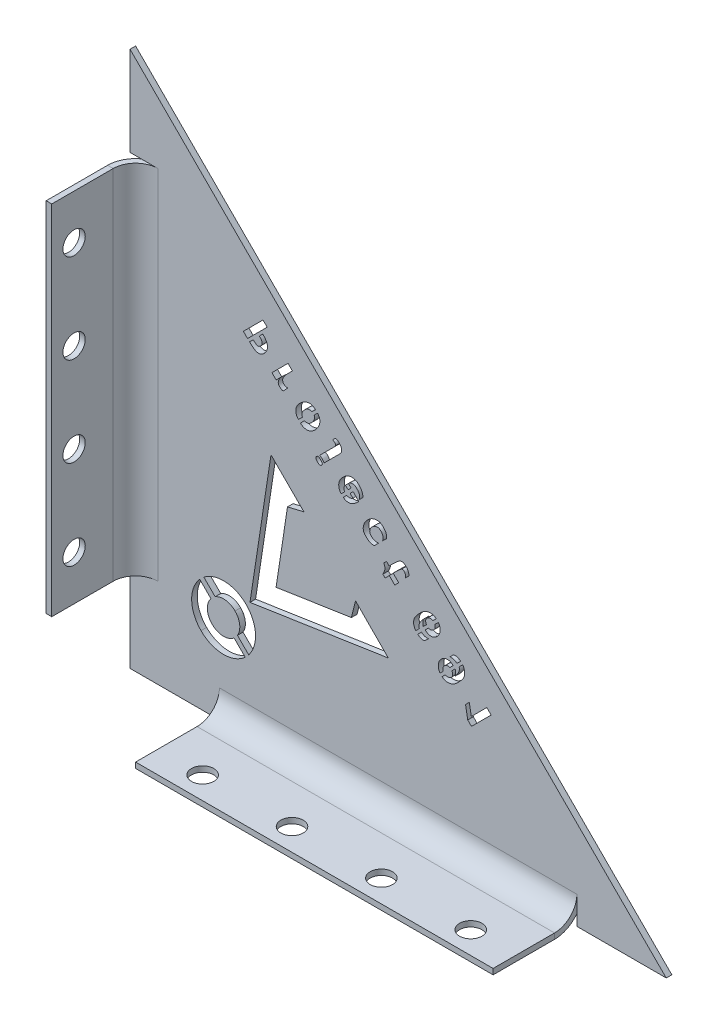
from build123d import *

# Parameters (mm, degrees)
BOSS_EXTRUDE1_DEPTH          = 1.5875
SKETCH7_W                    = 1.5875
SKETCH7_H                    = 101.6
BOSS_EXTRUDE2_DEPTH          = 0.0254
EDGE_FLANGE1_STRIP_W         = 19.05
EDGE_FLANGE1_STRIP_H         = 1.5875
EDGE_FLANGE1_STRIP_CUT_DEPTH = 101.6
EDGE_FLANGE1_DEPTH           = 101.6
SKETCH11_W                   = 101.6
SKETCH11_H                   = 1.5875
BOSS_EXTRUDE3_DEPTH          = 0.0254
EDGE_FLANGE2_STRIP_W         = 19.05
EDGE_FLANGE2_STRIP_H         = 1.5875
EDGE_FLANGE2_STRIP_CUT_DEPTH = 101.6
EDGE_FLANGE2_DEPTH           = 101.6
SKETCH15_R                   = 3.175
CUT_EXTRUDE1_DEPTH           = 2.54
SKETCH16_R                   = 3.175
CUT_EXTRUDE2_DEPTH           = 2.54
CUT_EXTRUDE3_DEPTH           = 2.54
CUT_EXTRUDE4_DEPTH           = 2.54


# Sheet-metal steps are written as plain solids
with BuildPart() as part:
    # Sketch1 → Boss-Extrude1 (new body)
    with BuildSketch(Plane.XY):
        Polygon((0, 119.481843199), (0, -32.918156801), (152.4, -32.918156801), align=None)
    extrude(amount=BOSS_EXTRUDE1_DEPTH)

    # Sketch7 → Boss-Extrude2 (add)
    with BuildSketch(Plane.ZY):
        with Locations((0.79375, 43.281843199)):
            Rectangle(SKETCH7_W, SKETCH7_H)
    extrude(amount=BOSS_EXTRUDE2_DEPTH)

    # Edge-Flange1 strip (across the edge) → Edge-Flange1 strip cut (cut)
    with BuildSketch(Plane(origin=(-0.0254, 94.081843199, 1.5875), x_dir=(1, 0, 0), z_dir=(0, -1, 0))):
        with Locations((-1.5875, -0.79375)):
            Rectangle(EDGE_FLANGE1_STRIP_W, EDGE_FLANGE1_STRIP_H)
    extrude(amount=EDGE_FLANGE1_STRIP_CUT_DEPTH, mode=Mode.SUBTRACT)

    # Edge-Flange1 section (across the edge) → Edge-Flange1 (add)
    with BuildSketch(Plane(origin=(-0.0254, 94.081843199, 1.5875), x_dir=(1, 0, 0), z_dir=(0, -1, 0))):
        with BuildLine():
            Line((0, 6.35), (0, 23.8125))
            Line((0, 23.8125), (1.5875, 23.8125))
            Line((1.5875, 23.8125), (1.5875, 6.35))
            ThreePointArc((1.5875, 6.35), (3.447371939, 1.859871939), (7.9375, 0))
            Line((7.9375, 0), (7.9375, -1.5875))
            ThreePointArc((7.9375, -1.5875), (2.324839924, 0.737339924), (0, 6.35))
        make_face()
    extrude(amount=EDGE_FLANGE1_DEPTH)

    # Sketch11 → Boss-Extrude3 (add)
    with BuildSketch(Plane(origin=(0, -32.918156801, 0), x_dir=(-1, 0, 0), z_dir=(0, -1, 0))):
        with Locations((-76.2, -0.79375)):
            Rectangle(SKETCH11_W, SKETCH11_H)
    extrude(amount=BOSS_EXTRUDE3_DEPTH)

    # Edge-Flange2 strip (across the edge) → Edge-Flange2 strip cut (cut)
    with BuildSketch(Plane(origin=(25.4, -32.943556801, 1.5875), x_dir=(0, 1, 0), z_dir=(1, 0, 0))):
        with Locations((-1.5875, -0.79375)):
            Rectangle(EDGE_FLANGE2_STRIP_W, EDGE_FLANGE2_STRIP_H)
    extrude(amount=EDGE_FLANGE2_STRIP_CUT_DEPTH, mode=Mode.SUBTRACT)

    # Edge-Flange2 section (across the edge) → Edge-Flange2 (add)
    with BuildSketch(Plane(origin=(25.4, -32.943556801, 1.5875), x_dir=(0, 1, 0), z_dir=(1, 0, 0))):
        with BuildLine():
            Line((0, 6.35), (0, 23.8125))
            Line((0, 23.8125), (1.5875, 23.8125))
            Line((1.5875, 23.8125), (1.5875, 6.35))
            ThreePointArc((1.5875, 6.35), (3.447371939, 1.859871939), (7.9375, 0))
            Line((7.9375, 0), (7.9375, -1.5875))
            ThreePointArc((7.9375, -1.5875), (2.324839924, 0.737339924), (0, 6.35))
        make_face()
    extrude(amount=EDGE_FLANGE2_DEPTH)

    # Sketch15 → Cut-Extrude1 (cut)
    with BuildSketch(Plane(origin=(0, -31.356056801, 0), x_dir=(1, 0, 0), z_dir=(0, 1, 0))):
        with Locations(Location((38.1, -19.05, 0), (0, 0, 270))):
            Circle(SKETCH15_R)
        with Locations(Location((63.5, -19.05, 0), (0, 0, 270))):
            Circle(SKETCH15_R)
        with Locations(Location((88.9, -19.05, 0), (0, 0, 270))):
            Circle(SKETCH15_R)
        with Locations(Location((114.3, -19.05, 0), (0, 0, 270))):
            Circle(SKETCH15_R)
    extrude(amount=-CUT_EXTRUDE1_DEPTH, mode=Mode.SUBTRACT)

    # Sketch16 → Cut-Extrude2 (cut)
    with BuildSketch(Plane(origin=(1.5621, 0, 0), x_dir=(0, 0, -1), z_dir=(1, 0, 0))):
        with Locations((-19.05, 81.381843199)):
            Circle(SKETCH16_R)
        with Locations((-19.05, 55.981843199)):
            Circle(SKETCH16_R)
        with Locations((-19.05, 30.581843199)):
            Circle(SKETCH16_R)
        with Locations((-19.05, 5.181843199)):
            Circle(SKETCH16_R)
    extrude(amount=-CUT_EXTRUDE2_DEPTH, mode=Mode.SUBTRACT)

    # Sketch18 → Cut-Extrude3 (cut)
    with BuildSketch(Plane(origin=(0, 0, 0), x_dir=(-1, 0, 0), z_dir=(0, 0, -1))):
        with BuildLine():
            Line((-62.918328796, 11.048103988), (-64.087135711, 15.755195036))
            Line((-64.087135711, 15.755195036), (-73.399282558, 6.348037368))
            Line((-73.399282558, 6.348037368), (-34.088047875, 0.383573675))
            Line((-34.088047875, 0.383573675), (-40.066632841, 39.680687084))
            Line((-40.066632841, 39.680687084), (-49.413539744, 30.333780181))
            Line((-49.413539744, 30.333780181), (-44.754388608, 29.212913177))
            add(Edge.make_bspline(
                [(-44.754388608, 29.212913177), (-43.939337688, 23.844729295), (-42.880097369, 16.867299609), (-41.50388878, 7.79941458)],
                knots=[0, 0, 0, 0, 1, 1, 1, 1], degree=3))
            add(Edge.make_bspline(
                [(-41.50388878, 7.79941458), (-50.571846226, 9.175550752), (-57.549710413, 10.233487569), (-62.918328796, 11.048103988)],
                knots=[0, 0, 0, 0, 1, 1, 1, 1], degree=3))
        make_face()
        with BuildLine():
            Line((-20.989695693, 0.025611542), (-24.192926626, -3.177619391))
            add(Edge.make_bspline(
                [(-29.846089839, -3.858384361), (-28.312500508, -2.324795029), (-25.966837326, -2.097873373), (-24.192926626, -3.177619391)],
                knots=[0, 0, 0, 0, 0.85203232, 0.85203232, 0.85203232, 0.85203232], degree=3))
            add(Edge.make_bspline(
                [(-30.526922938, -9.511615704), (-31.606653399, -7.737689446), (-31.379679171, -5.391973692), (-29.846089839, -3.858384361)],
                knots=[0.147967681, 0.147967681, 0.147967681, 0.147967681, 1, 1, 1, 1], degree=3))
            Line((-30.526922938, -9.511615704), (-33.73015778, -12.714850546))
            add(Edge.make_bspline(
                [(-33.73015778, -12.714850546), (-36.52704349, -9.153940448), (-36.284613381, -3.98259872), (-33.00280993, -0.700795269)],
                knots=[0.073871002, 0.073871002, 0.073871002, 0.073871002, 1, 1, 1, 1], degree=3))
            add(Edge.make_bspline(
                [(-33.00280993, -0.700795269), (-29.721878353, 2.580136308), (-24.550601032, 2.82250201), (-20.989695693, 0.025611542)],
                knots=[0, 0, 0, 0, 0.926128998, 0.926128998, 0.926128998, 0.926128998], degree=3))
        make_face()
        with BuildLine():
            Line((-29.567715607, -10.633621883), (-32.730234943, -13.796141219))
            add(Edge.make_bspline(
                [(-20.170048646, -13.533556552), (-23.624097654, -16.98760556), (-29.17123496, -17.074865519), (-32.730234943, -13.796141219)],
                knots=[0, 0, 0, 0, 0.974736908, 0.974736908, 0.974736908, 0.974736908], degree=3))
            add(Edge.make_bspline(
                [(-19.81220621, -1.080382551), (-16.631732942, -4.642721603), (-16.751035453, -10.114543359), (-20.170048646, -13.533556552)],
                knots=[0.034893843, 0.034893843, 0.034893843, 0.034893843, 1, 1, 1, 1], degree=3))
            Line((-19.81220621, -1.080382551), (-22.979590243, -4.247766584))
            add(Edge.make_bspline(
                [(-22.979590243, -4.247766584), (-21.536353783, -6.057312027), (-21.652389077, -8.701587801), (-23.327637738, -10.376836462)],
                knots=[0.06926452, 0.06926452, 0.06926452, 0.06926452, 1, 1, 1, 1], degree=3))
            add(Edge.make_bspline(
                [(-23.327637738, -10.376836462), (-25.03745463, -12.086653354), (-27.756767726, -12.172310571), (-29.567715607, -10.633621883)],
                knots=[0, 0, 0, 0, 0.949940915, 0.949940915, 0.949940915, 0.949940915], degree=3))
        make_face()
    extrude(amount=-CUT_EXTRUDE3_DEPTH, mode=Mode.SUBTRACT)

    # Sketch19 → Cut-Extrude4 (cut)
    with BuildSketch(Plane(origin=(0, 0, 0), x_dir=(-1, 0, 0), z_dir=(0, 0, -1))):
        with BuildLine():
            add(Edge.make_bspline(
                [(-54.451629709, 44.308400165), (-54.486216356, 44.347097669), (-54.552844966, 44.421645541), (-54.619431381, 44.554473369), (-54.644885888, 44.696657055), (-54.635652404, 44.845922248), (-54.586551979, 45.002877848), (-54.494039294, 45.164239512), (-54.370016404, 45.338062039), (-54.208899848, 45.506933329), (-54.038541356, 45.667558131), (-53.86728466, 45.796755143), (-53.705735912, 45.89260812), (-53.550339865, 45.947667342), (-53.401150145, 45.968395547), (-53.258558385, 45.944748504), (-53.125321358, 45.881598423), (-53.008521132, 45.783078955), (-52.908409106, 45.665084526), (-52.844147531, 45.525943286), (-52.818369511, 45.375023534), (-52.829681514, 45.214256535), (-52.880338366, 45.048503358), (-52.965261587, 44.877991305), (-53.089546945, 44.707389018), (-53.242168849, 44.54028881), (-53.406291032, 44.385842409), (-53.576008153, 44.2647164), (-53.738514348, 44.175383143), (-53.897071431, 44.122809093), (-54.050611902, 44.109146281), (-54.197235932, 44.13527054), (-54.333892833, 44.204126421), (-54.411237162, 44.272626479), (-54.451629709, 44.308400165)],
                knots=[0, 0, 0, 0, 0.89096093, 1.716370149, 2.519710242, 3.350237323, 4.268177873, 5.323688382, 6.539873258, 7.936784, 9.333694741, 10.567414482, 11.623893583, 12.554062634, 13.388976487, 14.188914126, 15.005781945, 15.896742875, 16.80159031, 17.649470878, 18.50136307, 19.41130979, 20.398285583, 21.466456066, 22.676900497, 24.018679477, 25.359804904, 26.548445057, 27.599284631, 28.541936938, 29.403380809, 30.226130366, 31.073608727, 32, 32, 32, 32], degree=3))
        make_face()
        Polygon((-97.041095461, 1.333701079), (-102.620099628, 6.912705246), (-101.390448586, 8.142356288), (-96.99810067, 3.750008371), (-96.421970461, 6.953980246), (-95.359139211, 5.891148996), (-95.98686317, 2.387933371), align=None)
        with BuildLine():
            Line((-93.953304581, 15.81339196), (-92.890473331, 14.75056071))
            add(Edge.make_bspline(
                [(-92.890473331, 14.75056071), (-92.827020703, 14.81059733), (-92.701447887, 14.929409864), (-92.492119234, 15.078359799), (-92.271478041, 15.202284832), (-92.037393519, 15.299625522), (-91.78672288, 15.368897662), (-91.518953423, 15.409021657), (-91.2324372, 15.423864597), (-91.036488157, 15.409695365), (-90.935070206, 15.402361752)],
                knots=[0, 0, 0, 0, 0.980817489, 1.941038821, 2.878509081, 3.820198868, 4.783140073, 5.793726477, 6.858092202, 8, 8, 8, 8], degree=3))
            Line((-90.935070206, 15.402361752), (-91.939428539, 16.406720085))
            add(Edge.make_bspline(
                [(-91.939428539, 16.406720085), (-91.993165972, 16.418939645), (-92.098857026, 16.442973138), (-92.258077532, 16.465620673), (-92.414584879, 16.474358391), (-92.568844285, 16.46923621), (-92.720262944, 16.450371927), (-92.868851097, 16.4176688), (-93.014099424, 16.370516387), (-93.198067554, 16.293917403), (-93.407190155, 16.189744697), (-93.627185453, 16.062698213), (-93.809767033, 15.943255505), (-93.908336009, 15.854076633), (-93.953304581, 15.81339196)],
                knots=[0, 0, 0, 0, 0.906066358, 1.782055884, 2.641294935, 3.480860537, 4.316978217, 5.147335385, 5.979189849, 6.824821184, 8.422826787, 9.816763711, 11.003976472, 12, 12, 12, 12], degree=3))
        make_face()
        with BuildLine():
            Line((-91.829361872, 13.689449252), (-90.900674372, 12.760761752))
            add(Edge.make_bspline(
                [(-90.900674372, 12.760761752), (-90.865046013, 12.778612267), (-90.786299141, 12.818066014), (-90.643909555, 12.853690463), (-90.471358878, 12.873514374), (-90.272722226, 12.884591741), (-90.054211337, 12.864226473), (-89.832377466, 12.782128668), (-89.616102321, 12.645750751), (-89.412378329, 12.464567674), (-89.229701124, 12.262953791), (-89.081677229, 12.05560123), (-88.978372056, 11.848737195), (-88.922837448, 11.643694736), (-88.90655937, 11.446448819), (-88.916750773, 11.259190232), (-88.961433038, 11.081178039), (-89.015975628, 10.974184384), (-89.043299372, 10.920584668)],
                knots=[0, 0, 0, 0, 0.572085397, 1.26444038, 2.09625672, 3.070483045, 4.124420694, 5.228059518, 6.43908216, 7.783856681, 9.138863522, 10.347129936, 11.439116606, 12.447625815, 13.383377729, 14.276112387, 15.136398451, 16, 16, 16, 16], degree=3))
            Line((-89.043299372, 10.920584668), (-88.123210831, 10.000496127))
            add(Edge.make_bspline(
                [(-88.123210831, 10.000496127), (-88.082613908, 10.04548828), (-88.000236962, 10.136783776), (-87.893894157, 10.292878584), (-87.809570633, 10.470904124), (-87.736046463, 10.66546123), (-87.683128216, 10.88049402), (-87.639940334, 11.113416514), (-87.620970711, 11.366235546), (-87.609935458, 11.632628123), (-87.623929923, 11.904280281), (-87.660394655, 12.17257981), (-87.72704783, 12.430825807), (-87.81613279, 12.681079235), (-87.934569663, 12.920789181), (-88.077536649, 13.152055351), (-88.247666053, 13.373173895), (-88.440077953, 13.581206228), (-88.645217386, 13.773318753), (-88.856778748, 13.942590593), (-89.071120764, 14.085769735), (-89.286140919, 14.206801892), (-89.50662817, 14.297554693), (-89.728506548, 14.366403101), (-89.95451886, 14.405135213), (-90.181072416, 14.421538348), (-90.40647744, 14.410248356), (-90.627217845, 14.37790837), (-90.842528353, 14.322683011), (-91.052166568, 14.242435821), (-91.256545267, 14.139011842), (-91.45560899, 14.012779996), (-91.647390526, 13.861639905), (-91.76774808, 13.747751393), (-91.829361872, 13.689449252)],
                knots=[0, 0, 0, 0, 0.749332702, 1.520502905, 2.326225067, 3.181293294, 4.089626218, 5.062179955, 6.108903827, 7.223051897, 8.359331748, 9.469748303, 10.567291151, 11.653221413, 12.75078718, 13.868789315, 15.012219258, 16.196922747, 17.371218932, 18.486698271, 19.545060865, 20.557780294, 21.533871024, 22.48975453, 23.426150137, 24.364585121, 25.294727598, 26.212564909, 27.120897833, 28.039063961, 28.98433606, 29.950480165, 30.950803785, 32, 32, 32, 32], degree=3))
        make_face()
        with BuildLine():
            add(Edge.make_bspline(
                [(-92.381414997, 13.137396127), (-92.401408019, 13.093668754), (-92.444054479, 13.000395323), (-92.488598898, 12.842843104), (-92.522393509, 12.662722038), (-92.545666044, 12.458206646), (-92.547858581, 12.224483646), (-92.51554026, 11.959650592), (-92.454557546, 11.662090246), (-92.395505671, 11.455065245), (-92.364217081, 11.34537321)],
                knots=[0, 0, 0, 0, 0.62829261, 1.340190433, 2.134471608, 3.024813884, 4.029827998, 5.184373668, 6.508142579, 8, 8, 8, 8], degree=3))
            add(Edge.make_bspline(
                [(-92.364217081, 11.34537321), (-92.431804593, 11.42117066), (-92.563634646, 11.569014269), (-92.748121922, 11.793046799), (-92.915441014, 12.013116992), (-93.064818903, 12.229703559), (-93.198429474, 12.441453372), (-93.313406893, 12.650347094), (-93.414677041, 12.854223543), (-93.493931047, 13.054527701), (-93.558434918, 13.244258279), (-93.603360511, 13.42132269), (-93.631244629, 13.583577491), (-93.635970005, 13.730845421), (-93.626231495, 13.864138642), (-93.59259236, 13.981852104), (-93.54348607, 14.087966721), (-93.493338721, 14.144506523), (-93.468323331, 14.17271071)],
                knots=[0, 0, 0, 0, 1.505393456, 2.936283515, 4.301144198, 5.602399503, 6.835634825, 8.011059706, 9.136095676, 10.2076363, 11.201985935, 12.104778921, 12.913735962, 13.636550114, 14.285162681, 14.885188552, 15.443889973, 16, 16, 16, 16], degree=3))
            Line((-93.468323331, 14.17271071), (-94.531154581, 15.23554196))
            add(Edge.make_bspline(
                [(-94.531154581, 15.23554196), (-94.546476559, 15.21925938), (-94.580136534, 15.183489113), (-94.624866186, 15.11754167), (-94.672730646, 15.039624409), (-94.725803286, 14.950321381), (-94.775106416, 14.844714445), (-94.83180932, 14.72845939), (-94.885241563, 14.596498155), (-94.964591032, 14.406586498), (-95.045562833, 14.15489064), (-95.10878384, 13.843435317), (-95.131915164, 13.525834903), (-95.120967072, 13.203011404), (-95.066775254, 12.87590739), (-94.968828804, 12.545691483), (-94.825629337, 12.214192568), (-94.674673474, 11.935822206), (-94.524157913, 11.70728388), (-94.388298876, 11.518439466), (-94.229532141, 11.315716781), (-94.048702919, 11.099068762), (-93.845366575, 10.869371199), (-93.621299048, 10.623896683), (-93.373454466, 10.365993214), (-93.111686754, 10.095666169), (-92.835532734, 9.834252467), (-92.549409162, 9.597323297), (-92.258512522, 9.390408532), (-91.964110859, 9.21282349), (-91.666761888, 9.063154132), (-91.36462485, 8.943783402), (-91.058274232, 8.854461593), (-90.750957517, 8.793542436), (-90.448500585, 8.765001506), (-90.156853799, 8.763232258), (-89.878878069, 8.794850197), (-89.614090896, 8.854300056), (-89.362594349, 8.946160682), (-89.126084254, 9.069236092), (-88.902988468, 9.221746894), (-88.769059657, 9.34358707), (-88.701060831, 9.40544821)],
                knots=[0, 0, 0, 0, 0.246047121, 0.54052682, 0.875339091, 1.254582366, 1.684013454, 2.158772054, 2.679702756, 3.252169111, 4.426864954, 5.586482217, 6.745910187, 7.928056321, 9.137963352, 10.389281836, 11.713984913, 13.110531903, 13.87271873, 14.728252196, 15.673472726, 16.709591897, 17.837528405, 19.053719, 20.371838385, 21.778989529, 23.200179869, 24.559848916, 25.869219826, 27.130291179, 28.345102835, 29.533444252, 30.704908277, 31.857102753, 32.980394827, 34.048003767, 35.06513386, 36.056634424, 37.031902402, 38.006679225, 38.987943888, 40, 40, 40, 40], degree=3))
            Line((-88.701060831, 9.40544821), (-89.629748331, 10.33413571))
            add(Edge.make_bspline(
                [(-89.629748331, 10.33413571), (-89.667487721, 10.303972747), (-89.750294481, 10.237789978), (-89.916911043, 10.177856954), (-90.121639488, 10.141549584), (-90.315636636, 10.125537564), (-90.483888708, 10.128606499), (-90.611927818, 10.146088424), (-90.736579024, 10.177041387), (-90.857187765, 10.222539547), (-90.975133653, 10.27927401), (-91.089030024, 10.35050112), (-91.199480749, 10.435279992), (-91.304338185, 10.532368431), (-91.401669469, 10.636673511), (-91.483896193, 10.748005897), (-91.555569602, 10.859843007), (-91.613311908, 10.975374478), (-91.653794574, 11.095501683), (-91.684556654, 11.217806572), (-91.697059713, 11.343923344), (-91.699148886, 11.509206567), (-91.678715482, 11.702608574), (-91.632770637, 11.909392159), (-91.564301943, 12.083441729), (-91.494334179, 12.174398274), (-91.461326456, 12.217307585)],
                knots=[0, 0, 0, 0, 0.941398391, 2.065591195, 3.415888152, 5.015585384, 5.869499527, 6.708209235, 7.541789172, 8.38049888, 9.229449441, 10.102141201, 11.007470802, 11.953414455, 12.899358108, 13.797904023, 14.661075357, 15.499935466, 16.320473825, 17.1404739, 17.965305893, 18.796536752, 20.376834823, 21.76085807, 22.943670992, 24, 24, 24, 24], degree=3))
            Line((-91.461326456, 12.217307585), (-92.381414997, 13.137396127))
        make_face()
        with BuildLine():
            add(Edge.make_bspline(
                [(-82.835806409, 17.444519299), (-82.899276743, 17.384517912), (-83.024884601, 17.265775107), (-83.234365557, 17.116022379), (-83.456635712, 16.993714048), (-83.690121662, 16.893140388), (-83.941359555, 16.824782847), (-84.209539563, 16.783621475), (-84.496772528, 16.771872643), (-84.693243474, 16.785621819), (-84.794649117, 16.792718257)],
                knots=[0, 0, 0, 0, 0.979072112, 1.937584718, 2.879005898, 3.821503001, 4.78273064, 5.791518692, 6.860124242, 8, 8, 8, 8], degree=3))
            Line((-84.794649117, 16.792718257), (-83.790290784, 15.788359924))
            add(Edge.make_bspline(
                [(-83.790290784, 15.788359924), (-83.736553267, 15.776140095), (-83.630862048, 15.752106074), (-83.471642739, 15.729462378), (-83.315130996, 15.72071055), (-83.160887569, 15.725884025), (-83.00940992, 15.744558952), (-82.861208896, 15.777926107), (-82.71529998, 15.822374328), (-82.53093164, 15.899848018), (-82.322187091, 16.005602228), (-82.099535947, 16.130639576), (-81.917237408, 16.251493961), (-81.817985241, 16.341067258), (-81.772975159, 16.381688049)],
                knots=[0, 0, 0, 0, 0.904693802, 1.779356334, 2.637293765, 3.475587551, 4.310438636, 5.139537936, 5.967300108, 6.811650437, 8.419848378, 9.806986057, 11.0054853, 12, 12, 12, 12], degree=3))
            Line((-81.772975159, 16.381688049), (-82.835806409, 17.444519299))
        make_face()
        with BuildLine():
            add(Edge.make_bspline(
                [(-84.827325159, 19.436038049), (-84.854564989, 19.416011652), (-84.917873529, 19.369467973), (-85.051622074, 19.336000663), (-85.222401135, 19.313369317), (-85.390322439, 19.305807729), (-85.538844038, 19.313379107), (-85.654314521, 19.33259974), (-85.768038128, 19.365369098), (-85.880772719, 19.412722561), (-85.991897258, 19.472673176), (-86.101555887, 19.546191287), (-86.209251038, 19.632330901), (-86.314707258, 19.728622122), (-86.412016616, 19.834446058), (-86.497697852, 19.945576316), (-86.570635578, 20.060199473), (-86.63154299, 20.177218872), (-86.678216999, 20.298346281), (-86.711251917, 20.422905492), (-86.729741686, 20.551014973), (-86.73636408, 20.67882448), (-86.732295804, 20.800401531), (-86.732199117, 20.910531316), (-86.726915331, 21.006336768), (-86.719387485, 21.087024179), (-86.714040591, 21.153453017), (-86.703536642, 21.204403556), (-86.6931487, 21.242501832), (-86.681042255, 21.260337021), (-86.6761012, 21.267616174)],
                knots=[0, 0, 0, 0, 0.85560708, 1.988530585, 3.450300191, 5.264639633, 6.260510601, 7.238733058, 8.242833179, 9.271849073, 10.351149459, 11.458117423, 12.633996484, 13.865282824, 15.096569164, 16.295489222, 17.439209424, 18.557320352, 19.654201837, 20.742868331, 21.836627571, 22.949277022, 24.002010568, 24.937797688, 25.757685454, 26.447304249, 27.005929431, 27.453212033, 27.776837077, 28, 28, 28, 28], degree=3))
            Line((-86.6761012, 21.267616174), (-87.596189742, 22.187704716))
            add(Edge.make_bspline(
                [(-87.596189742, 22.187704716), (-87.637728652, 22.14296701), (-87.721860968, 22.0523559), (-87.823727289, 21.893035781), (-87.912848886, 21.717662182), (-87.984190299, 21.522284359), (-88.040709462, 21.308092454), (-88.081368704, 21.075064093), (-88.106985863, 20.823367105), (-88.115231911, 20.55732204), (-88.105093864, 20.286098857), (-88.066690875, 20.019394393), (-88.00360697, 19.761297398), (-87.910808177, 19.51319339), (-87.795838463, 19.271960291), (-87.651786714, 19.041979957), (-87.484019898, 18.819577756), (-87.291221465, 18.612266303), (-87.08629021, 18.41995225), (-86.874529132, 18.251001171), (-86.660556892, 18.106679856), (-86.443395396, 17.989088161), (-86.223192969, 17.897339708), (-86.0011858, 17.828722992), (-85.775209653, 17.789940142), (-85.54863697, 17.773514425), (-85.323272028, 17.784943402), (-85.101699225, 17.816859237), (-84.886247078, 17.874327814), (-84.67579939, 17.954236263), (-84.471463579, 18.057823395), (-84.272387939, 18.184009906), (-84.080609703, 18.335162549), (-83.960251688, 18.449049306), (-83.898637659, 18.507350549)],
                knots=[0, 0, 0, 0, 0.754218705, 1.527583814, 2.330364635, 3.185698592, 4.096112628, 5.068968605, 6.110304904, 7.224799218, 8.361099975, 9.464837378, 10.55411321, 11.642811209, 12.737618736, 13.855968312, 14.995454345, 16.180526003, 17.355187124, 18.471013122, 19.529704623, 20.545567307, 21.521961377, 22.478141943, 23.414828553, 24.353555175, 25.283986712, 26.20210926, 27.119381554, 28.03783302, 28.983398881, 29.949843235, 30.950477726, 32, 32, 32, 32], degree=3))
            Line((-83.898637659, 18.507350549), (-84.827325159, 19.436038049))
        make_face()
        with BuildLine():
            Line((-87.002861617, 22.798230757), (-86.082773075, 21.878142216))
            add(Edge.make_bspline(
                [(-86.082773075, 21.878142216), (-86.044871819, 21.905930097), (-85.960944985, 21.967462329), (-85.795847099, 22.020790953), (-85.593785164, 22.057947286), (-85.401441526, 22.069670037), (-85.233761598, 22.070616466), (-85.106494158, 22.052079461), (-84.98244418, 22.022979749), (-84.861844006, 21.979782755), (-84.744377551, 21.922487015), (-84.630501994, 21.852040666), (-84.521577106, 21.766029622), (-84.416608609, 21.669757196), (-84.320167289, 21.565314289), (-84.236117771, 21.455302533), (-84.166067973, 21.342327166), (-84.107940027, 21.226601503), (-84.066573427, 21.106725659), (-84.039779282, 20.984300568), (-84.022589608, 20.858810508), (-84.025326256, 20.69323029), (-84.044069242, 20.500179566), (-84.088299276, 20.293540468), (-84.156881026, 20.120257674), (-84.226806252, 20.029287244), (-84.259793909, 19.986371382)],
                knots=[0, 0, 0, 0, 0.920246832, 2.037753089, 3.370223432, 4.965495549, 5.823278378, 6.666006617, 7.489935579, 8.328801025, 9.181819185, 10.058692295, 10.959424894, 11.90990087, 12.860376847, 13.754225126, 14.631098236, 15.473977597, 16.298447423, 17.1198218, 17.938711394, 18.78513434, 20.373004133, 21.750129612, 22.938609776, 24, 24, 24, 24], degree=3))
            Line((-84.259793909, 19.986371382), (-83.339705367, 19.066282841))
            add(Edge.make_bspline(
                [(-83.339705367, 19.066282841), (-83.337314023, 19.070825874), (-83.329849873, 19.085006136), (-83.320709741, 19.115741412), (-83.310995106, 19.16244899), (-83.299460155, 19.224596971), (-83.282656563, 19.302099147), (-83.269007958, 19.396648977), (-83.248774741, 19.506306227), (-83.223146292, 19.67714832), (-83.200083667, 19.911374552), (-83.214468037, 20.211186826), (-83.265055902, 20.529873402), (-83.324327096, 20.744731513), (-83.355183492, 20.856585966)],
                knots=[0, 0, 0, 0, 0.101550044, 0.316970218, 0.630996386, 1.047382525, 1.568414415, 2.201169797, 2.938457384, 3.776629817, 5.622774983, 7.588561941, 9.703419321, 12, 12, 12, 12], degree=3))
            add(Edge.make_bspline(
                [(-83.355183492, 20.856585966), (-83.287303255, 20.781607125), (-83.154573218, 20.634996792), (-82.973627848, 20.408484908), (-82.806184355, 20.189093034), (-82.655239839, 19.973520094), (-82.523259363, 19.76072166), (-82.407628428, 19.551664722), (-82.306470336, 19.347722247), (-82.227162937, 19.147435536), (-82.162757197, 18.957697243), (-82.117532783, 18.780646007), (-82.090589978, 18.618328731), (-82.082877984, 18.471160091), (-82.093298383, 18.337815205), (-82.126777427, 18.22010834), (-82.175921929, 18.113992148), (-82.226064323, 18.057452551), (-82.251077242, 18.029248466)],
                knots=[0, 0, 0, 0, 1.499452607, 2.931963819, 4.297215525, 5.591857327, 6.832659565, 8.008421198, 9.133779482, 10.205627096, 11.200261605, 12.103313234, 12.912502037, 13.635873002, 14.284671392, 14.884869166, 15.443730651, 16, 16, 16, 16], degree=3))
            Line((-82.251077242, 18.029248466), (-81.19684495, 16.957818257))
            add(Edge.make_bspline(
                [(-81.19684495, 16.957818257), (-81.164179404, 16.996563853), (-81.088849575, 17.08591485), (-80.991285161, 17.260333751), (-80.882860731, 17.48277451), (-80.773383265, 17.749701653), (-80.672485601, 18.045286858), (-80.611242392, 18.358091752), (-80.586771431, 18.676129746), (-80.600765441, 18.998929363), (-80.65448586, 19.326522356), (-80.751584996, 19.657118322), (-80.896008538, 19.988117314), (-81.046402267, 20.266159075), (-81.196986602, 20.494658721), (-81.332746952, 20.683579992), (-81.491674328, 20.885698052), (-81.670617264, 21.103423202), (-81.874019484, 21.333142335), (-82.099990598, 21.576828175), (-82.345764815, 21.837238665), (-82.609503672, 22.105690072), (-82.88609003, 22.367630819), (-83.171070382, 22.606614143), (-83.462561002, 22.812380504), (-83.755350527, 22.992364129), (-84.05416074, 23.137380642), (-84.354335763, 23.258746111), (-84.660045603, 23.346085515), (-84.966337587, 23.404124193), (-85.26746366, 23.434548396), (-85.557815343, 23.432156697), (-85.834419011, 23.404782844), (-86.097276399, 23.343805937), (-86.346098962, 23.252122688), (-86.581290615, 23.131118465), (-86.802632384, 22.980202934), (-86.935431491, 22.859512552), (-87.002861617, 22.798230757)],
                knots=[0, 0, 0, 0, 0.502037088, 1.157744874, 1.97454839, 2.959285973, 4.01902647, 5.069008332, 6.113240045, 7.17816074, 8.267856111, 9.400307047, 10.588158337, 11.845949846, 12.532408751, 13.302939737, 14.15424683, 15.083789136, 16.099658256, 17.198862789, 18.382099562, 19.653432753, 20.933419144, 22.161626123, 23.340903029, 24.471809323, 25.568493029, 26.633474518, 27.681496838, 28.718136979, 29.724159769, 30.680022608, 31.595476004, 32.477375997, 33.350403549, 34.220664323, 35.096523834, 36, 36, 36, 36], degree=3))
        make_face()
        with BuildLine():
            Line((-73.676579668, 26.78948354), (-75.248469251, 25.217593956))
            Line((-75.248469251, 25.217593956), (-76.368053626, 26.337178331))
            Line((-76.368053626, 26.337178331), (-74.778966126, 27.926265831))
            add(Edge.make_bspline(
                [(-74.778966126, 27.926265831), (-74.864319861, 28.011744827), (-75.030158668, 28.177827012), (-75.272647007, 28.418604234), (-75.501402091, 28.643877587), (-75.715853685, 28.85366241), (-75.917456305, 29.047077221), (-76.106610855, 29.223023373), (-76.28020712, 29.386048067), (-76.441946532, 29.531534914), (-76.589042036, 29.662623033), (-76.723741565, 29.776103607), (-76.844092482, 29.874945753), (-76.951361241, 29.956991361), (-77.045614583, 30.023286358), (-77.125035179, 30.07540189), (-77.192322812, 30.111019777), (-77.263485507, 30.136710415), (-77.344390906, 30.14830907), (-77.437539133, 30.15068767), (-77.529790866, 30.138417449), (-77.620568148, 30.111883346), (-77.71061434, 30.071702526), (-77.799648895, 30.018005765), (-77.888651692, 29.951548654), (-77.976018828, 29.871668108), (-78.05808797, 29.774150407), (-78.129955402, 29.657378377), (-78.194077286, 29.522114944), (-78.246190167, 29.367178227), (-78.288858371, 29.193329621), (-78.323199418, 29.000368673), (-78.346420492, 28.787739741), (-78.35508239, 28.639454153), (-78.359572376, 28.562588748)],
                knots=[0, 0, 0, 0, 2.101008207, 4.082172786, 5.943522058, 7.68509019, 9.300008141, 10.802546222, 12.178252559, 13.441861742, 14.586194535, 15.604965906, 16.505040786, 17.294744402, 17.953113938, 18.509065358, 18.94607414, 19.274048666, 19.819894317, 20.358405463, 20.891442757, 21.431060434, 21.997990298, 22.601610091, 23.235750963, 23.927261849, 24.656216208, 25.444659925, 26.305439678, 27.254545304, 28.282303508, 29.416689186, 30.660913489, 32, 32, 32, 32], degree=3))
            Line((-78.359572376, 28.562588748), (-79.279660918, 29.48267729))
            add(Edge.make_bspline(
                [(-79.279660918, 29.48267729), (-79.277684024, 29.575693828), (-79.273784669, 29.759165731), (-79.232633413, 30.029533805), (-79.165981726, 30.290287669), (-79.070331564, 30.541580716), (-78.947286758, 30.783506831), (-78.796753855, 31.017241448), (-78.616905654, 31.240247072), (-78.415692061, 31.449896022), (-78.202433377, 31.636793464), (-77.983747097, 31.787833665), (-77.766174911, 31.900335171), (-77.549912852, 31.975985062), (-77.332561346, 32.004703505), (-77.117012354, 31.996636987), (-76.90316316, 31.947320402), (-76.727955916, 31.872267016), (-76.584859352, 31.790456477), (-76.464467616, 31.714551041), (-76.333215708, 31.624337075), (-76.190667652, 31.519764581), (-76.038213846, 31.398359479), (-75.873190064, 31.265466151), (-75.69901299, 31.115471421), (-75.511643401, 30.953902194), (-75.316198406, 30.773615083), (-75.108070149, 30.58104754), (-74.887475822, 30.375759857), (-74.658973336, 30.151859034), (-74.416774593, 29.916545418), (-74.166008807, 29.663964911), (-73.902095978, 29.399881274), (-73.724502416, 29.216910956), (-73.633584876, 29.123240831)],
                knots=[0, 0, 0, 0, 1.085389273, 2.140892794, 3.184807694, 4.222868981, 5.273607416, 6.348647858, 7.463021242, 8.61342064, 9.738059799, 10.768496461, 11.708500936, 12.591179862, 13.428961146, 14.252964721, 15.097351619, 15.976291711, 16.467810808, 17.02124563, 17.637646695, 18.327129035, 19.085054335, 19.913017793, 20.800960146, 21.768794264, 22.801706426, 23.905353264, 25.079785544, 26.320015897, 27.64064166, 29.02272206, 30.475807449, 32, 32, 32, 32], degree=3))
            Line((-73.633584876, 29.123240831), (-72.880316126, 29.859311665))
            Line((-72.880316126, 29.859311665), (-72.085772376, 29.064767915))
            add(Edge.make_bspline(
                [(-72.085772376, 29.064767915), (-72.121749229, 29.002823226), (-72.192004912, 28.881857493), (-72.278150882, 28.695332957), (-72.345373849, 28.510505915), (-72.396384284, 28.327855224), (-72.427013076, 28.146260973), (-72.44151049, 27.966667482), (-72.436686788, 27.7883895), (-72.40196749, 27.552955027), (-72.331148337, 27.258503346), (-72.209145653, 26.907688681), (-72.055083542, 26.554596325), (-71.926222577, 26.32749645), (-71.860479668, 26.21163354)],
                knots=[0, 0, 0, 0, 0.849700362, 1.659296869, 2.434018451, 3.181594192, 3.906287857, 4.615849473, 5.316815592, 6.017187309, 7.436196407, 8.903354277, 10.420138338, 12, 12, 12, 12], degree=3))
            Line((-71.860479668, 26.21163354), (-72.496802585, 25.558112706))
            Line((-72.496802585, 25.558112706), (-73.676579668, 26.78948354))
        make_face()
        with BuildLine():
            add(Edge.make_bspline(
                [(-70.665807659, 33.263915965), (-70.562760443, 33.252037362), (-70.362822022, 33.228989779), (-70.069553807, 33.230508319), (-69.793365107, 33.254764939), (-69.530581552, 33.309076544), (-69.278293944, 33.40285238), (-69.031336708, 33.535185854), (-68.790526611, 33.711997156), (-68.596899653, 33.88638437), (-68.451800541, 34.04324844), (-68.355775827, 34.169067301), (-68.278988257, 34.302123908), (-68.216129236, 34.438968129), (-68.168978121, 34.580668906), (-68.140159518, 34.728065952), (-68.12649751, 34.880205669), (-68.128037312, 35.036421709), (-68.14699774, 35.195704102), (-68.184925741, 35.355560881), (-68.242529771, 35.515108981), (-68.319202836, 35.673397039), (-68.412397493, 35.832512794), (-68.525076568, 35.990876212), (-68.656290947, 36.149365174), (-68.803866117, 36.303887983), (-68.95839307, 36.452243638), (-69.119760141, 36.58235344), (-69.279138062, 36.699763794), (-69.442610886, 36.795678686), (-69.606800682, 36.873518925), (-69.771729796, 36.93494634), (-69.938379149, 36.977732522), (-70.105411177, 37.00352656), (-70.269749386, 37.013136141), (-70.429380249, 37.001781897), (-70.582975156, 36.976775007), (-70.731211595, 36.933649935), (-70.872213322, 36.87031901), (-71.009846996, 36.793000553), (-71.139972684, 36.696039775), (-71.3019681, 36.547956472), (-71.480681109, 36.350175532), (-71.65409143, 36.100194497), (-71.788150701, 35.849492967), (-71.869523943, 35.588449349), (-71.910561838, 35.316606014), (-71.916645136, 35.028319334), (-71.885929835, 34.719405039), (-71.842439388, 34.509845196), (-71.819787867, 34.400698257)],
                knots=[0, 0, 0, 0, 1.470542692, 2.853235619, 4.152202258, 5.39967885, 6.647712132, 7.957683506, 9.361764752, 10.87618873, 11.647627645, 12.39103021, 13.116416951, 13.822532992, 14.524703169, 15.229740991, 15.948439463, 16.688631542, 17.442242091, 18.219532929, 19.01449555, 19.84395181, 20.711608562, 21.62780905, 22.598390114, 23.628264403, 24.658138692, 25.635004099, 26.56727354, 27.464209558, 28.319193501, 29.14264638, 29.95737668, 30.755702436, 31.537575595, 32.287446119, 33.021535637, 33.742164492, 34.470554541, 35.210031285, 35.977860104, 36.766808421, 38.321730491, 39.747668001, 41.075445872, 42.338443232, 43.60611978, 44.964801815, 46.419150403, 48, 48, 48, 48], degree=3))
            Line((-71.819787867, 34.400698257), (-72.9066962, 35.48760659))
            add(Edge.make_bspline(
                [(-72.9066962, 35.48760659), (-72.918403373, 35.597526674), (-72.941113068, 35.810750792), (-72.932486466, 36.12459628), (-72.886513319, 36.420252806), (-72.815030334, 36.655213408), (-72.734923711, 36.839710279), (-72.653846777, 36.984834676), (-72.556121447, 37.138603736), (-72.440162007, 37.301536665), (-72.303485881, 37.470503893), (-72.150988031, 37.649435879), (-71.978786024, 37.835771097), (-71.793814658, 38.02884106), (-71.591874686, 38.212972326), (-71.369838873, 38.36712655), (-71.134167828, 38.490357197), (-70.885164798, 38.582313013), (-70.622518912, 38.640652254), (-70.347169591, 38.667792965), (-70.058285893, 38.663666414), (-69.759713142, 38.628188795), (-69.458069193, 38.567296516), (-69.161438791, 38.47890012), (-68.872825304, 38.366467245), (-68.591705191, 38.229991472), (-68.317928967, 38.069730001), (-68.05182567, 37.885139149), (-67.79558304, 37.673777885), (-67.548653467, 37.442177007), (-67.316980236, 37.19483224), (-67.104464415, 36.938885985), (-66.916609633, 36.674626436), (-66.750655611, 36.404515618), (-66.608519018, 36.126448064), (-66.492212131, 35.840575799), (-66.396856662, 35.548175619), (-66.324311008, 35.252405278), (-66.281384453, 34.958191472), (-66.267151685, 34.673262212), (-66.290205534, 34.401252182), (-66.343401906, 34.141606684), (-66.429628487, 33.894356847), (-66.549625019, 33.660209375), (-66.702652856, 33.439562508), (-66.886236201, 33.238789404), (-67.078124014, 33.053259011), (-67.262147287, 32.879956112), (-67.436977676, 32.726256918), (-67.600292683, 32.588673652), (-67.755471447, 32.472111936), (-67.89997259, 32.371214156), (-68.034830812, 32.288871828), (-68.204181552, 32.200440307), (-68.431097553, 32.122625724), (-68.729214646, 32.057166199), (-69.066238737, 32.024243891), (-69.303104199, 32.025176143), (-69.427557659, 32.025665965)],
                knots=[0, 0, 0, 0, 1.212110388, 2.351264303, 3.43418508, 4.486934378, 5.036295743, 5.638814002, 6.309033391, 7.0352594, 7.832092646, 8.693261309, 9.614991124, 10.61601471, 11.627501145, 12.608313668, 13.573505734, 14.538861815, 15.512627365, 16.517990897, 17.568708004, 18.676846608, 19.813200097, 20.941864807, 22.069283915, 23.208854694, 24.367712417, 25.547471964, 26.759010776, 28.009707902, 29.260405029, 30.475939234, 31.657793749, 32.815540923, 33.952242666, 35.080819703, 36.198932209, 37.325051617, 38.418520337, 39.457513304, 40.448622668, 41.406094968, 42.359154594, 43.312982207, 44.28503911, 45.296525545, 46.293051283, 47.214437506, 48.070234978, 48.847556726, 49.557216224, 50.199418809, 50.780978401, 51.290260338, 52.293239224, 53.401431403, 54.634664375, 56, 56, 56, 56], degree=3))
            Line((-69.427557659, 32.025665965), (-70.665807659, 33.263915965))
        make_face()
        with BuildLine():
            Line((-63.401519343, 42.299589698), (-62.548502676, 41.446573032))
            Line((-62.548502676, 41.446573032), (-63.351645384, 40.643430323))
            add(Edge.make_bspline(
                [(-63.351645384, 40.643430323), (-63.304360757, 40.61370488), (-63.212333688, 40.555852138), (-63.072800746, 40.479358302), (-62.934567394, 40.417256523), (-62.799351919, 40.367874781), (-62.667603834, 40.328360544), (-62.537825131, 40.30491795), (-62.410618932, 40.291612896), (-62.251053308, 40.295901256), (-62.069812359, 40.313887183), (-61.88108504, 40.357673299), (-61.724858037, 40.416113146), (-61.647249335, 40.479743496), (-61.611216218, 40.509286573)],
                knots=[0, 0, 0, 0, 1.080366058, 2.102647872, 3.075552691, 4.008840917, 4.886296197, 5.732425285, 6.556760715, 7.355329272, 8.816413178, 10.069944751, 11.103890339, 12, 12, 12, 12], degree=3))
            Line((-61.611216218, 40.509286573), (-60.617176634, 39.498049073))
            add(Edge.make_bspline(
                [(-60.617176634, 39.498049073), (-60.668273435, 39.450895769), (-60.770606065, 39.356460861), (-60.944637246, 39.237298725), (-61.134430461, 39.139470392), (-61.339965817, 39.06165164), (-61.561170837, 39.003097771), (-61.79861591, 38.965869829), (-62.051775554, 38.949966253), (-62.271904655, 38.950037668), (-62.456535531, 38.964390765), (-62.600650285, 38.991345384), (-62.749229148, 39.028779074), (-62.900535465, 39.081252228), (-63.055853567, 39.145559817), (-63.216040777, 39.220761266), (-63.378915362, 39.311073185), (-63.54647923, 39.412307853), (-63.716319603, 39.528749192), (-63.89148992, 39.654980977), (-64.069450109, 39.795547276), (-64.251037146, 39.948983702), (-64.439050151, 40.112921145), (-64.627475867, 40.293376362), (-64.822198556, 40.483368639), (-64.950823378, 40.616716768), (-65.016403718, 40.684705323)],
                knots=[0, 0, 0, 0, 0.978268325, 1.959198429, 2.959475274, 3.979115361, 5.048404036, 6.176663684, 7.358206194, 8.61775121, 9.274169846, 9.963100784, 10.679810482, 11.430460591, 12.216116228, 13.046780638, 13.921181679, 14.837838197, 15.802991469, 16.820423536, 17.878373968, 18.99586468, 20.168574398, 21.390794942, 22.669677026, 24, 24, 24, 24], degree=3))
            Line((-65.016403718, 40.684705323), (-63.401519343, 42.299589698))
        make_face()
        with BuildLine():
            add(Edge.make_bspline(
                [(-66.161784968, 42.215319907), (-66.163877608, 42.337502818), (-66.167956764, 42.575672401), (-66.129426329, 42.923170677), (-66.055364462, 43.249225865), (-65.963580178, 43.508037312), (-65.863454342, 43.707555353), (-65.77451573, 43.864505927), (-65.665885886, 44.025942197), (-65.544833609, 44.1964344), (-65.404879256, 44.371693249), (-65.247140802, 44.552532024), (-65.073989582, 44.740664889), (-64.888533858, 44.933820171), (-64.687981215, 45.117811057), (-64.468224618, 45.27469356), (-64.235313174, 45.405157535), (-63.989275167, 45.509062138), (-63.728495655, 45.582267425), (-63.456136082, 45.631585316), (-63.16957922, 45.648482458), (-62.872451887, 45.642819932), (-62.569147295, 45.605044319), (-62.265617859, 45.534340994), (-61.965970504, 45.427186481), (-61.66615559, 45.292149764), (-61.372627768, 45.117116682), (-61.078504642, 44.913846295), (-60.788322862, 44.67547397), (-60.506210944, 44.408964544), (-60.240114469, 44.127514321), (-60.003298203, 43.838215548), (-59.800841888, 43.546984896), (-59.632145402, 43.253434116), (-59.499398774, 42.957169269), (-59.399650436, 42.658970285), (-59.3355264, 42.358951849), (-59.307258159, 42.059477916), (-59.307446926, 41.767031613), (-59.332464794, 41.485327265), (-59.384477038, 41.217571178), (-59.459832523, 40.963019964), (-59.561347, 40.722634106), (-59.690649161, 40.497281681), (-59.843255767, 40.284318297), (-59.963316294, 40.156048414), (-60.023848509, 40.091377198)],
                knots=[0, 0, 0, 0, 1.250245971, 2.437088431, 3.569076056, 4.668313061, 5.237939865, 5.853132467, 6.514085654, 7.229170028, 7.99368854, 8.809250996, 9.68579403, 10.611430026, 11.550754987, 12.467809102, 13.369156445, 14.279404135, 15.195311684, 16.137164031, 17.107803571, 18.129389843, 19.176309578, 20.231310085, 21.313569498, 22.429880817, 23.592616785, 24.807276671, 26.087947032, 27.433335938, 28.778724844, 30.05113656, 31.257628516, 32.40647363, 33.512600023, 34.576170705, 35.620322463, 36.64650182, 37.650209355, 38.6110024, 39.537679983, 40.438339042, 41.324673318, 42.202689056, 43.093830289, 44, 44, 44, 44], degree=3))
            Line((-60.023848509, 40.091377198), (-61.026487051, 41.09401574))
            add(Edge.make_bspline(
                [(-61.026487051, 41.09401574), (-60.996895371, 41.130038217), (-60.931666921, 41.209441967), (-60.874057616, 41.369965608), (-60.826727573, 41.564945531), (-60.808032836, 41.752183095), (-60.803444134, 41.916374587), (-60.817437647, 42.044174716), (-60.847994008, 42.169803397), (-60.888427024, 42.295896446), (-60.948720032, 42.419197983), (-61.020405492, 42.543705123), (-61.109210465, 42.665961798), (-61.176132318, 42.744323014), (-61.210504759, 42.784570948)],
                knots=[0, 0, 0, 0, 0.903544933, 1.991669157, 3.279951243, 4.821064787, 5.648621548, 6.480924246, 7.319065636, 8.167733314, 9.058104403, 9.990191133, 10.967720779, 12, 12, 12, 12], degree=3))
            Line((-61.210504759, 42.784570948), (-61.963773509, 42.031302198))
            Line((-61.963773509, 42.031302198), (-62.816790176, 42.884318865))
            Line((-62.816790176, 42.884318865), (-62.080719343, 43.620389698))
            add(Edge.make_bspline(
                [(-62.080719343, 43.620389698), (-62.130513051, 43.665864107), (-62.227734248, 43.754651959), (-62.379992971, 43.871139069), (-62.533152518, 43.968755494), (-62.68515911, 44.048346103), (-62.838083257, 44.107755559), (-62.991088479, 44.147333866), (-63.143854198, 44.170988689), (-63.297046009, 44.171711685), (-63.447997719, 44.156124712), (-63.598032798, 44.124978641), (-63.745410739, 44.076531982), (-63.891664375, 44.011948408), (-64.035526167, 43.931189603), (-64.177753456, 43.833357894), (-64.318314208, 43.720386891), (-64.496906666, 43.550772517), (-64.698418377, 43.331841431), (-64.902301413, 43.064135983), (-65.060786951, 42.800744983), (-65.169184932, 42.532873504), (-65.234878775, 42.25383005), (-65.268392023, 41.954355772), (-65.2699207, 41.628005167), (-65.245695661, 41.403424977), (-65.233097468, 41.286632407)],
                knots=[0, 0, 0, 0, 0.926881133, 1.809716432, 2.63188109, 3.421552325, 4.165152289, 4.882080827, 5.591035742, 6.284709184, 6.981955984, 7.674508971, 8.387396485, 9.110881119, 9.86957585, 10.652253287, 11.481940194, 12.346284746, 14.036614124, 15.567333766, 16.966475357, 18.250127918, 19.523356455, 20.896049401, 22.385795441, 24, 24, 24, 24], degree=3))
            Line((-65.233097468, 41.286632407), (-66.161784968, 42.215319907))
        make_face()
        with BuildLine():
            Line((-55.151584917, 45.228488707), (-59.024555751, 49.10145954))
            add(Edge.make_bspline(
                [(-59.024555751, 49.10145954), (-59.104023906, 49.177912902), (-59.255358601, 49.323506394), (-59.465185137, 49.536337105), (-59.647068852, 49.732063876), (-59.798530035, 49.912799848), (-59.923238095, 50.075904825), (-60.020843048, 50.221483425), (-60.09071247, 50.351203866), (-60.143232071, 50.502379229), (-60.169237545, 50.683694356), (-60.173028352, 50.898167427), (-60.147201366, 51.116118018), (-60.086890006, 51.336946876), (-59.993182223, 51.563252949), (-59.856922393, 51.792628439), (-59.686232854, 52.030380908), (-59.47955661, 52.267953489), (-59.247128429, 52.494281594), (-58.988843028, 52.685687187), (-58.715450009, 52.843159057), (-58.520150434, 52.914653122), (-58.422628667, 52.95035329)],
                knots=[0, 0, 0, 0, 1.313058618, 2.500515132, 3.558498388, 4.493696926, 5.307398226, 6.00223707, 6.579288815, 7.056395538, 7.900316486, 8.746883652, 9.606288671, 10.503754546, 11.464683434, 12.513754264, 13.67311483, 14.945897839, 16.259133886, 17.527460853, 18.765351198, 20, 20, 20, 20], degree=3))
            Line((-58.422628667, 52.95035329), (-57.562732834, 52.10421579))
            add(Edge.make_bspline(
                [(-57.562732834, 52.10421579), (-57.621761052, 52.081977369), (-57.739634038, 52.03756964), (-57.907218658, 51.947855717), (-58.06729647, 51.843396698), (-58.213632644, 51.725031669), (-58.334752203, 51.599342425), (-58.420009251, 51.467296872), (-58.450693395, 51.328622991), (-58.437415844, 51.2126373), (-58.399452473, 51.121014783), (-58.357872556, 51.041316572), (-58.299754519, 50.953504973), (-58.227586178, 50.856279983), (-58.141372397, 50.749186682), (-58.039474519, 50.634715472), (-57.923769302, 50.510161179), (-57.840420643, 50.425480567), (-57.796624501, 50.38098454)],
                knots=[0, 0, 0, 0, 1.26221103, 2.520499297, 3.797506931, 5.086843162, 6.281001894, 7.285246161, 8.190632635, 9.069344025, 9.574672131, 10.170397604, 10.867861653, 11.680799787, 12.595313518, 13.620346416, 14.749594175, 16, 16, 16, 16], degree=3))
            Line((-57.796624501, 50.38098454), (-53.897856792, 46.482216832))
            add(Edge.make_bspline(
                [(-53.897856792, 46.482216832), (-53.973027771, 46.43650218), (-54.110962088, 46.352618486), (-54.298040977, 46.236215666), (-54.441056417, 46.132066468), (-54.539465728, 46.054449816), (-54.603865084, 45.986502163), (-54.656944818, 45.924305163), (-54.7186259, 45.846673253), (-54.789624864, 45.753546938), (-54.867318305, 45.643584526), (-54.956507865, 45.520026069), (-55.049386037, 45.378186021), (-55.116442568, 45.27996398), (-55.151584917, 45.228488707)],
                knots=[0, 0, 0, 0, 1.759088976, 3.227824625, 4.401527018, 5.296594676, 5.726159894, 6.270608295, 6.931036154, 7.708049, 8.611296298, 9.622457169, 10.753999961, 12, 12, 12, 12], degree=3))
        make_face()
        with BuildLine():
            Line((-53.277528692, 56.540761599), (-52.298967234, 55.562200141))
            add(Edge.make_bspline(
                [(-52.298967234, 55.562200141), (-52.314660904, 55.542658623), (-52.347579258, 55.501669195), (-52.383168498, 55.425943682), (-52.408100874, 55.33698954), (-52.425328907, 55.235517367), (-52.43096744, 55.120860898), (-52.429584841, 54.993262493), (-52.416221851, 54.852705389), (-52.396847549, 54.700716482), (-52.36351863, 54.541071272), (-52.309263609, 54.380353098), (-52.2396865, 54.218735558), (-52.15331208, 54.05620958), (-52.047673659, 53.894024427), (-51.927293171, 53.729211239), (-51.787046815, 53.567035196), (-51.634894799, 53.405839082), (-51.475131654, 53.25439371), (-51.314582369, 53.118273203), (-51.159218108, 52.998452766), (-51.004463329, 52.90002205), (-50.854169231, 52.817848249), (-50.704820479, 52.757942678), (-50.560086857, 52.713230317), (-50.418251498, 52.690125708), (-50.284129897, 52.680063725), (-50.158832451, 52.680137196), (-50.043056969, 52.68785978), (-49.937006216, 52.706515964), (-49.840750841, 52.734379023), (-49.754060527, 52.769947473), (-49.676688864, 52.816266985), (-49.633816573, 52.856181662), (-49.61265265, 52.875885557)],
                knots=[0, 0, 0, 0, 0.509914314, 1.069573822, 1.691290079, 2.39114546, 3.164442275, 4.029963088, 4.9924541, 6.042741925, 7.15525837, 8.312842859, 9.496829744, 10.742021004, 12.062383264, 13.442461627, 14.902530966, 16.432989034, 17.963447102, 19.390544105, 20.726149741, 21.962190328, 23.128954668, 24.214842503, 25.239821645, 26.212701458, 27.139279938, 27.981331415, 28.767085997, 29.50350967, 30.173408564, 30.807648606, 31.41139528, 32, 32, 32, 32], degree=3))
            Line((-49.61265265, 52.875885557), (-48.441474525, 51.704707432))
            add(Edge.make_bspline(
                [(-48.441474525, 51.704707432), (-48.508540588, 51.640357675), (-48.64025404, 51.513978871), (-48.855020716, 51.348968112), (-49.08170976, 51.212916648), (-49.31816289, 51.101468926), (-49.566032567, 51.019192045), (-49.823522716, 50.961533946), (-50.091720307, 50.933492162), (-50.368236273, 50.929116871), (-50.65067703, 50.956209819), (-50.933722528, 51.019274972), (-51.216731803, 51.115087918), (-51.498698937, 51.244882091), (-51.780749364, 51.408628139), (-52.062956414, 51.604890989), (-52.343003474, 51.837341439), (-52.618871016, 52.096220606), (-52.879955827, 52.374466159), (-53.117539642, 52.6604553), (-53.325315964, 52.951450265), (-53.505762644, 53.245198542), (-53.653425679, 53.545125369), (-53.77312392, 53.848216572), (-53.865613481, 54.154510141), (-53.92441751, 54.46296764), (-53.957136634, 54.76625551), (-53.955261478, 55.059803046), (-53.923531665, 55.341111801), (-53.857606537, 55.609029127), (-53.760857396, 55.863942973), (-53.631856292, 56.105265519), (-53.471831856, 56.334082379), (-53.342945349, 56.471178257), (-53.277528692, 56.540761599)],
                knots=[0, 0, 0, 0, 0.915688622, 1.798353814, 2.66276161, 3.517194172, 4.369531525, 5.231868349, 6.112958597, 7.022770408, 7.953863491, 8.902620793, 9.874682919, 10.893682801, 11.956906106, 13.085493235, 14.277816867, 15.541044521, 16.812259312, 18.036400036, 19.20299283, 20.333911563, 21.430646117, 22.493584095, 23.543024237, 24.579175914, 25.584485044, 26.545098405, 27.466764942, 28.368539824, 29.257405052, 30.147203736, 31.059608807, 32, 32, 32, 32], degree=3))
        make_face()
        with BuildLine():
            add(Edge.make_bspline(
                [(-52.699678692, 57.118611599), (-52.625524349, 57.18861766), (-52.480843679, 57.325204721), (-52.242291548, 57.496273848), (-51.995502456, 57.635856362), (-51.737525049, 57.739552443), (-51.469971636, 57.809424671), (-51.192462728, 57.842991974), (-50.905008984, 57.844908752), (-50.610025145, 57.810779525), (-50.311228242, 57.747136487), (-50.013397663, 57.653450428), (-49.717983625, 57.532672956), (-49.42566021, 57.381910379), (-49.137176054, 57.199926487), (-48.849833572, 56.991550935), (-48.564645149, 56.755135228), (-48.29022619, 56.491896498), (-48.029763495, 56.216943018), (-47.798981622, 55.93453907), (-47.59967448, 55.652647615), (-47.434467323, 55.368597244), (-47.302909803, 55.083174075), (-47.205919726, 54.795961281), (-47.141198663, 54.508363213), (-47.110383752, 54.221551205), (-47.111296686, 53.940405818), (-47.136128755, 53.668330542), (-47.189337284, 53.40746977), (-47.270918696, 53.158578954), (-47.378139283, 52.920604871), (-47.51339149, 52.695143133), (-47.673869764, 52.479206112), (-47.799624012, 52.348883128), (-47.863624525, 52.282557432)],
                knots=[0, 0, 0, 0, 1.002106775, 1.955185287, 2.879112195, 3.784827752, 4.681990229, 5.591191914, 6.527221392, 7.502965003, 8.506023146, 9.527922657, 10.569788203, 11.641572868, 12.758662075, 13.921505521, 15.130777942, 16.399081077, 17.659639545, 18.853804893, 19.983235187, 21.051915397, 22.081362994, 23.069201959, 24.028183487, 24.975288624, 25.90002386, 26.789319929, 27.658510595, 28.512628033, 29.360543679, 30.220226668, 31.094214238, 32, 32, 32, 32], degree=3))
            Line((-47.863624525, 52.282557432), (-49.03480265, 53.453735557))
            add(Edge.make_bspline(
                [(-49.03480265, 53.453735557), (-49.016856917, 53.473808778), (-48.979863381, 53.51518794), (-48.937463752, 53.5901862), (-48.904878555, 53.676127993), (-48.880640256, 53.773050198), (-48.868044833, 53.88161749), (-48.863082393, 54.001163872), (-48.866633284, 54.13163776), (-48.880290489, 54.272597106), (-48.906530008, 54.420579454), (-48.95281851, 54.571749613), (-49.014560244, 54.725320617), (-49.096386745, 54.880447616), (-49.196730249, 55.037279617), (-49.316121624, 55.195109038), (-49.45241539, 55.355110006), (-49.603248013, 55.514269532), (-49.762495829, 55.665683939), (-49.924726778, 55.802031376), (-50.085027988, 55.921685287), (-50.244807801, 56.024019386), (-50.40565655, 56.107028401), (-50.565699836, 56.172377209), (-50.724250523, 56.222130163), (-50.880571042, 56.249434146), (-51.02877665, 56.266773148), (-51.166151247, 56.273958612), (-51.290096287, 56.27158653), (-51.40114422, 56.265670636), (-51.498190818, 56.243533676), (-51.582918552, 56.217122398), (-51.656224298, 56.181940314), (-51.694243253, 56.147841746), (-51.712518275, 56.131451182)],
                knots=[0, 0, 0, 0, 0.55052319, 1.134854688, 1.752261315, 2.430389736, 3.176449401, 3.987818828, 4.880966702, 5.848866428, 6.888072374, 7.954803038, 9.082660569, 10.275460814, 11.543197902, 12.894203941, 14.327733983, 15.84848314, 17.385840177, 18.828343815, 20.188766417, 21.482634054, 22.712126865, 23.892364846, 25.022117474, 26.109669046, 27.138463984, 28.079468326, 28.925397164, 29.679552411, 30.352368505, 30.957925782, 31.499093821, 32, 32, 32, 32], degree=3))
            Line((-51.712518275, 56.131451182), (-52.699678692, 57.118611599))
        make_face()
        with BuildLine():
            Line((-44.91011041, 64.622694464), (-40.333744785, 60.046328839))
            Line((-40.333744785, 60.046328839), (-41.530719785, 58.849353839))
            Line((-41.530719785, 58.849353839), (-42.627946869, 59.946580922))
            add(Edge.make_bspline(
                [(-42.627946869, 59.946580922), (-42.567332582, 59.851497913), (-42.447395071, 59.663357129), (-42.306287242, 59.361844558), (-42.200911165, 59.050376518), (-42.141921242, 58.784559523), (-42.118643507, 58.571145825), (-42.123967114, 58.414900053), (-42.149532069, 58.264306623), (-42.197182079, 58.118368028), (-42.266357521, 57.978343829), (-42.355038681, 57.84193592), (-42.466476828, 57.713603409), (-42.593579028, 57.592174585), (-42.728411939, 57.482828069), (-42.8592007, 57.382984956), (-42.986396586, 57.300436373), (-43.108269638, 57.233256344), (-43.224564985, 57.179953994), (-43.33598597, 57.144150509), (-43.44275307, 57.121294641), (-43.512386876, 57.119915434), (-43.546315619, 57.119243422)],
                knots=[0, 0, 0, 0, 1.831579523, 3.624147071, 5.395293838, 7.168278415, 8.039004971, 8.878191141, 9.700916472, 10.514299586, 11.364537963, 12.233017479, 13.151836843, 14.120711122, 15.08720713, 15.972523049, 16.794509136, 17.549414969, 18.233529412, 18.870100684, 19.449461898, 20, 20, 20, 20], degree=3))
            Line((-43.546315619, 57.119243422), (-44.801763535, 58.491637172))
            add(Edge.make_bspline(
                [(-44.801763535, 58.491637172), (-44.725251235, 58.49782932), (-44.58084929, 58.509515783), (-44.380614865, 58.553767337), (-44.206764075, 58.609161625), (-44.018614847, 58.716031805), (-43.819782312, 58.874636862), (-43.623711426, 59.035188894), (-43.495959749, 59.204497768), (-43.432997594, 59.375612779), (-43.397049131, 59.583202262), (-43.390868774, 59.779149152), (-43.397015694, 59.950896576), (-43.421114918, 60.085350031), (-43.455251984, 60.220754241), (-43.503993832, 60.357041668), (-43.566279824, 60.494060205), (-43.640499457, 60.633189684), (-43.730283903, 60.771459624), (-43.870746262, 60.962402413), (-44.071937688, 61.209307098), (-44.341036449, 61.518432752), (-44.641501073, 61.848721587), (-44.856767474, 62.071665619), (-44.968583327, 62.187469464)],
                knots=[0, 0, 0, 0, 0.997551892, 1.882683345, 2.663478042, 3.361180467, 4.682950339, 5.971468173, 6.644367148, 7.414507052, 8.317190985, 9.377339499, 9.959919997, 10.549761379, 11.150398995, 11.775592113, 12.429962374, 13.107434882, 13.825417179, 14.572899857, 16.190991603, 17.967717291, 19.905510907, 22, 22, 22, 22], degree=3))
            Line((-44.968583327, 62.187469464), (-46.165558327, 63.367246547))
            Line((-46.165558327, 63.367246547), (-44.91011041, 64.622694464))
        make_face()
        with BuildLine():
            Line((-37.734374738, 68.252219719), (-36.747214321, 67.265059303))
            add(Edge.make_bspline(
                [(-36.747214321, 67.265059303), (-36.808496715, 67.203648096), (-36.92597746, 67.085920412), (-37.086811775, 66.908587368), (-37.224399422, 66.738480872), (-37.340804757, 66.577457666), (-37.432746826, 66.423715058), (-37.502970814, 66.278466463), (-37.551161621, 66.14075606), (-37.573860638, 66.008774845), (-37.576956741, 65.882639884), (-37.564933883, 65.759576535), (-37.537220074, 65.638178778), (-37.49314757, 65.519311241), (-37.436758115, 65.400650868), (-37.360658704, 65.286154106), (-37.274117566, 65.169548063), (-37.169322394, 65.061180048), (-37.061103043, 64.958668488), (-36.951228826, 64.868083767), (-36.844067895, 64.79015611), (-36.736539769, 64.72821106), (-36.631311333, 64.678167425), (-36.52600363, 64.646763902), (-36.423264549, 64.624350969), (-36.317920952, 64.618138932), (-36.204098785, 64.635539594), (-36.078282561, 64.678320011), (-35.938039422, 64.749852306), (-35.782250435, 64.846803257), (-35.610374781, 64.970390867), (-35.421071315, 65.117677232), (-35.218629098, 65.294784533), (-35.079849284, 65.422824459), (-35.006785155, 65.490234303)],
                knots=[0, 0, 0, 0, 1.610580025, 3.087544871, 4.442221001, 5.670786108, 6.773250137, 7.763450751, 8.662076533, 9.472204851, 10.238797324, 10.998114911, 11.762339526, 12.543423526, 13.347869124, 14.195175911, 15.091340305, 16.040062035, 16.988783764, 17.858194763, 18.682186652, 19.445224582, 20.159576088, 20.839563805, 21.480358006, 22.109106968, 22.786424128, 23.604275748, 24.565746896, 25.702956629, 27.008234343, 28.4942977, 30.154334711, 32, 32, 32, 32], degree=3))
            Line((-35.006785155, 65.490234303), (-33.954272655, 64.437721803))
            add(Edge.make_bspline(
                [(-33.954272655, 64.437721803), (-34.049996975, 64.349353489), (-34.234137438, 64.179363436), (-34.509020066, 63.944783486), (-34.763878998, 63.73103542), (-35.006818822, 63.548176967), (-35.231292118, 63.388013346), (-35.442308752, 63.257418112), (-35.6355276, 63.148804657), (-35.817399169, 63.068325198), (-35.989366436, 63.009410986), (-36.154513904, 62.963343814), (-36.317086409, 62.93511456), (-36.475535589, 62.916536042), (-36.630637808, 62.914492301), (-36.781766615, 62.929604675), (-36.930212201, 62.954013894), (-37.126038824, 63.011306763), (-37.369563671, 63.117941527), (-37.658268223, 63.290403026), (-37.947961854, 63.512239918), (-38.185528122, 63.72909896), (-38.367860168, 63.924599319), (-38.495682342, 64.079057244), (-38.609199854, 64.239948223), (-38.711463907, 64.404792923), (-38.798845524, 64.576066093), (-38.875765904, 64.751860537), (-38.936505639, 64.934165853), (-39.003346803, 65.180246972), (-39.052006238, 65.490272548), (-39.064493882, 65.859971561), (-39.021456164, 66.221606529), (-38.946297703, 66.518330466), (-38.852696523, 66.755532703), (-38.758471678, 66.942684675), (-38.644282973, 67.140077714), (-38.506757683, 67.345540729), (-38.344599457, 67.559177708), (-38.16364919, 67.784116844), (-37.957551982, 68.016491212), (-37.810499217, 68.171814077), (-37.734374738, 68.252219719)],
                knots=[0, 0, 0, 0, 1.545404627, 2.972823665, 4.286860452, 5.490672612, 6.579378234, 7.556938829, 8.433541038, 9.206953876, 9.912433808, 10.588860259, 11.238533479, 11.86791916, 12.480055052, 13.074246175, 13.667970045, 14.262122244, 15.49003453, 16.810392214, 18.242712124, 19.811922737, 20.620366117, 21.412802566, 22.188395256, 22.954748655, 23.71214707, 24.467649923, 25.229007583, 25.989544634, 27.491169268, 28.940376086, 30.364388585, 31.797870594, 32.558164332, 33.385468792, 34.281355922, 35.262223086, 36.316392052, 37.462471591, 38.686403294, 40, 40, 40, 40], degree=3))
        make_face()
        Polygon((-38.979503905, 70.553300969), (-37.792847655, 71.739957219), (-32.213843488, 66.160953053), (-33.400499738, 64.974296803), align=None)
    extrude(amount=-CUT_EXTRUDE4_DEPTH, mode=Mode.SUBTRACT)


solid = part.part
